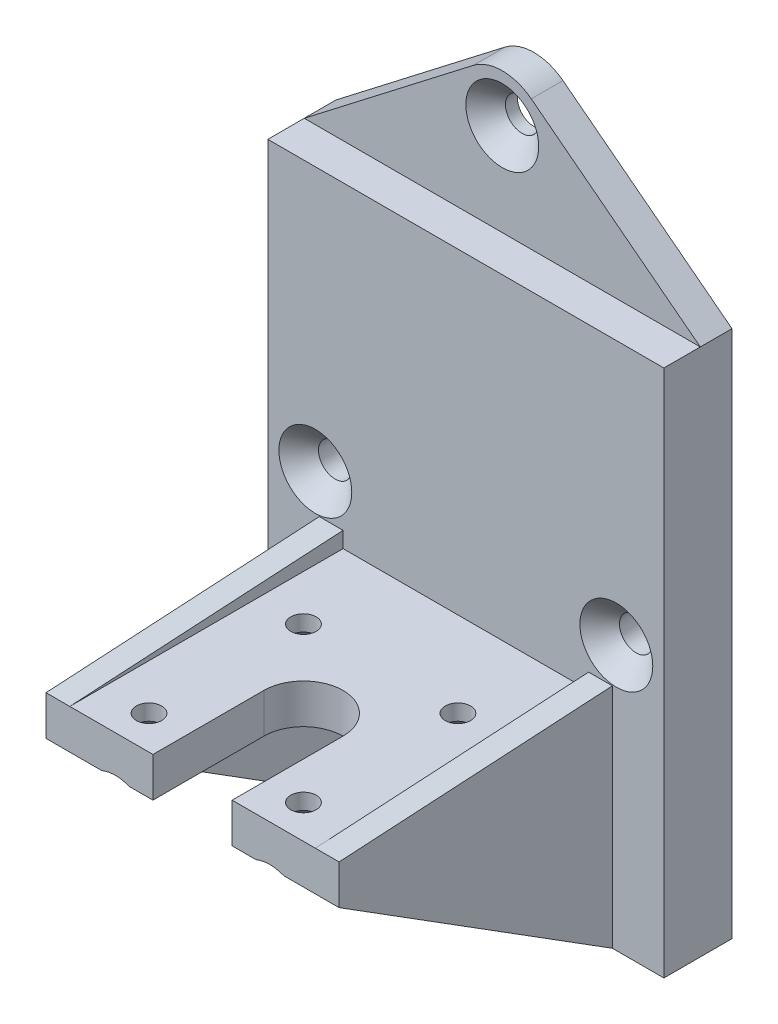
from build123d import *

# Parameters (mm, degrees)
BOSS_EXTRUDE1_DEPTH      = 2.6
BOSS_EXTRUDE1_DEPTH_BACK = 6
SKETCH3_W                = 50
SKETCH3_H                = 66.691620804
BOSS_EXTRUDE2_DEPTH      = 4
SKETCH8_R                = 2.1
CUT_EXTRUDE4_DEPTH       = 63.560770456
CHAMFER1_SIZE            = 2.5
SKETCH9_W                = 37
SKETCH9_H                = 5
BOSS_EXTRUDE3_DEPTH      = 34.5
SKETCH10_R               = 1.6
CUT_EXTRUDE5_DEPTH       = 74.011642907
BOSS_EXTRUDE4_DEPTH      = 3
CHAMFER2_SIZE            = 3


with BuildPart() as part:
    # Sketch3 → Boss-Extrude1 (new, two sides: drawn at the far end of the back side and taken through both)
    with BuildSketch(Plane.XY.offset(-BOSS_EXTRUDE1_DEPTH_BACK)):
        with Locations((0, 5.654189598)):
            Rectangle(SKETCH3_W, SKETCH3_H)
    extrude(amount=BOSS_EXTRUDE1_DEPTH + BOSS_EXTRUDE1_DEPTH_BACK)

    # Sketch7 → Boss-Extrude2 (add)
    with BuildSketch(Plane(origin=(0, 0, -6), x_dir=(-1, 0, 0), z_dir=(0, 0, -1))):
        with BuildLine():
            Line((-25, 39), (-3.663721376, 55.451541401))
            ThreePointArc((-3.663721376, 55.451541401), (0, 56.7), (3.663721376, 55.451541401))
            Line((3.663721376, 55.451541401), (25, 39))
            Line((25, 39), (-25, 39))
        make_face()
    extrude(amount=-BOSS_EXTRUDE2_DEPTH)

    # Sketch8 → Cut-Extrude4 (cut, through all)
    with BuildSketch(Plane.XY.offset(2.6)):
        with Locations((-19, 5.7)):
            Circle(SKETCH8_R)
        with Locations((19, 5.7)):
            Circle(SKETCH8_R)
        with Locations((0, 50.7)):
            Circle(SKETCH8_R)
    extrude(amount=-CUT_EXTRUDE4_DEPTH, mode=Mode.SUBTRACT)

    # Chamfer1
    chamfer1_edges = [part.edges().sort_by_distance(p)[0] for p in [
        (-21.1, 5.7, 2.6),
        (16.9, 5.7, 2.6),
        (-2.1, 50.7, -2),
    ]]
    chamfer(chamfer1_edges, length=CHAMFER1_SIZE)

    # Sketch9 → Boss-Extrude3 (add)
    with BuildSketch(Plane.XY.offset(2.6)):
        with Locations((0, -3.5)):
            Rectangle(SKETCH9_W, SKETCH9_H)
    extrude(amount=BOSS_EXTRUDE3_DEPTH)

    # Sketch10 → Cut-Extrude5 (cut, through all)
    with BuildSketch(Plane(origin=(0, -1, 0), x_dir=(1, 0, 0), z_dir=(0, 1, 0))):
        with Locations(Location((9.75, -13.35, 0), (0, 0, 270))):
            Circle(SKETCH10_R)
        with Locations(Location((9.75, -32.85, 0), (0, 0, 270))):
            Circle(SKETCH10_R)
        with Locations(Location((-9.75, -32.85, 0), (0, 0, 270))):
            Circle(SKETCH10_R)
        with Locations(Location((-9.75, -13.35, 0), (0, 0, 270))):
            Circle(SKETCH10_R)
        with BuildLine():
            Line((-5, -23.1), (-5, -37.1))
            Line((-5, -37.1), (5, -37.1))
            Line((5, -37.1), (5, -23.1))
            ThreePointArc((5, -23.1), (0, -18.1), (-5, -23.1))
        make_face()
    extrude(amount=-CUT_EXTRUDE5_DEPTH, mode=Mode.SUBTRACT)

    # Sketch11 → Boss-Extrude4 (add)
    with BuildSketch(Plane.ZY.offset(18.5)):
        Polygon((2.6, -1), (2.6, 1), (37.1, -1), align=None)
        Polygon((2.6, -6), (2.6, -27.691620804), (37.1, -6), align=None)
    boss_extrude4 = extrude(amount=-BOSS_EXTRUDE4_DEPTH)

    # Mirror1: Boss-Extrude4 across plane
    add(boss_extrude4.mirror(Plane(origin=(0, 0, 0), x_dir=(0, 0, 1), z_dir=(1, 0, 0))))

    # Chamfer2
    # the kernel refuses this chamfer: 3 mm, written as the material it takes off along each edge
    with BuildSketch(Plane(origin=(9.75, -6, 32.85), x_dir=(0, 0, 1), z_dir=(-1, 0, 0))) as chamfer2_piece_1:
        Polygon((1.6 + CHAMFER2_SIZE, 0), (1.6, CHAMFER2_SIZE), (1.6, 0), align=None)
    revolve(axis=Axis((9.75, -6, 32.85), (0, 1, 0)), mode=Mode.SUBTRACT)
    with BuildSketch(Plane(origin=(-9.75, -6, 32.85), x_dir=(0, 0, 1), z_dir=(-1, 0, 0))) as chamfer2_piece_2:
        Polygon((1.6 + CHAMFER2_SIZE, 0), (1.6, CHAMFER2_SIZE), (1.6, 0), align=None)
    revolve(axis=Axis((-9.75, -6, 32.85), (0, 1, 0)), mode=Mode.SUBTRACT)
    with BuildSketch(Plane(origin=(-9.75, -6, 13.35), x_dir=(0, 0, 1), z_dir=(-1, 0, 0))) as chamfer2_piece_3:
        Polygon((1.6 + CHAMFER2_SIZE, 0), (1.6, CHAMFER2_SIZE), (1.6, 0), align=None)
    revolve(axis=Axis((-9.75, -6, 13.35), (0, 1, 0)), mode=Mode.SUBTRACT)
    with BuildSketch(Plane(origin=(9.75, -6, 13.35), x_dir=(0, 0, 1), z_dir=(-1, 0, 0))) as chamfer2_piece_4:
        Polygon((1.6 + CHAMFER2_SIZE, 0), (1.6, CHAMFER2_SIZE), (1.6, 0), align=None)
    revolve(axis=Axis((9.75, -6, 13.35), (0, 1, 0)), mode=Mode.SUBTRACT)


solid = part.part
